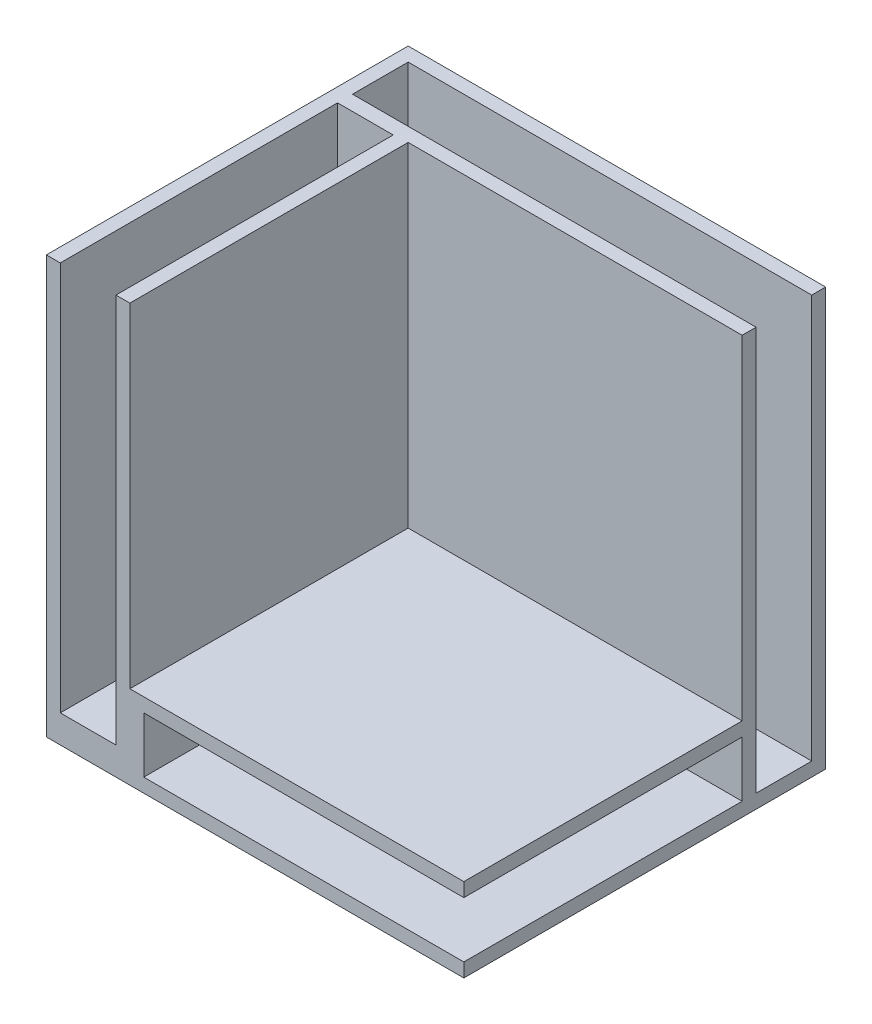
from build123d import *

# Parameters (mm, degrees)
SKETCH1_W            = 30
SKETCH1_H            = 30
BOSS_EXTRUDE1_DEPTH  = 6
BOSS_EXTRUDE4_DEPTH  = 20
SKETCH4_W            = 2
SKETCH4_H            = 2
BOSS_EXTRUDE6_DEPTH  = 20
SKETCH5_W            = 24
SKETCH5_H            = 6
BOSS_EXTRUDE7_DEPTH  = 20
SHELL2_START         = 7
SHELL2_DEPTH         = 23
SHELL2_START_2       = 1
SHELL2_2_DEPTH       = 4
SHELL2_START_3       = 5
SHELL2_3_OUTLINE_W   = 29
SHELL2_3_OUTLINE_H   = 4
SHELL2_3_DEPTH       = 2
SKETCH7_W            = 23
SKETCH7_H            = 1
BOSS_EXTRUDE8_DEPTH  = 5
SKETCH9_W            = 1.075143629
SKETCH9_H            = 23
BOSS_EXTRUDE9_DEPTH  = 5
SKETCH10_W           = 4
SKETCH10_H           = 23
CUT_EXTRUDE1_DEPTH   = 10
SKETCH11_W           = 23
SKETCH11_H           = 4
CUT_EXTRUDE2_DEPTH   = 10
BOSS_EXTRUDE11_DEPTH = 20
SKETCH14_W           = 4
SKETCH14_H           = 19.924856371
CUT_EXTRUDE4_DEPTH   = 5


# Read off the part's stored shape, not the designer's step: Shell2
with BuildPart() as part:
    # Sketch1 → Boss-Extrude1 (new body)
    with BuildSketch(Plane.XY):
        with Locations((15, 15)):
            Rectangle(SKETCH1_W, SKETCH1_H)
    extrude(amount=BOSS_EXTRUDE1_DEPTH)

    # Sketch2 → Boss-Extrude4 (add)
    with BuildSketch(Plane.XY.offset(6)):
        Polygon((5, 6), (6, 6), (6, 30), (0, 30), (0, 6), align=None)
    extrude(amount=BOSS_EXTRUDE4_DEPTH)

    # Sketch4 → Boss-Extrude6 (add)
    with BuildSketch(Plane.XY.offset(6)):
        with Locations((5, 5)):
            Rectangle(SKETCH4_W, SKETCH4_H)
    extrude(amount=BOSS_EXTRUDE6_DEPTH)

    # Sketch5 → Boss-Extrude7 (add)
    with BuildSketch(Plane.XY.offset(6)):
        with Locations((18, 3)):
            Rectangle(SKETCH5_W, SKETCH5_H)
    extrude(amount=BOSS_EXTRUDE7_DEPTH)

    # Shell2 outline → Shell2 (cut)
    with BuildSketch(Plane(origin=(0, 0, 0), x_dir=(1, 0, 0), z_dir=(0, 1, 0)).offset(SHELL2_START)):
        Polygon((5, -5), (30, -5), (30, -1), (1, -1), (1, -25), (5, -25), align=None)
    extrude(amount=SHELL2_DEPTH, mode=Mode.SUBTRACT)

    # Shell2 2 outline → Shell2 2 (cut)
    with BuildSketch(Plane(origin=(0, 0, 0), x_dir=(1, 0, 0), z_dir=(0, 1, 0)).offset(SHELL2_START_2)):
        Polygon((7, -5), (7, -25), (30, -25), (30, -1), (1, -1), (1, -5), align=None)
    extrude(amount=SHELL2_2_DEPTH, mode=Mode.SUBTRACT)

    # Shell2 3 outline → Shell2 3 (cut)
    with BuildSketch(Plane(origin=(0, 0, 0), x_dir=(1, 0, 0), z_dir=(0, 1, 0)).offset(SHELL2_START_3)):
        with Locations((15.5, -3)):
            Rectangle(SHELL2_3_OUTLINE_W, SHELL2_3_OUTLINE_H)
    extrude(amount=SHELL2_3_DEPTH, mode=Mode.SUBTRACT)

    # Sketch7 → Boss-Extrude8 (add)
    with BuildSketch(Plane.XZ.offset(-5)):
        with Locations((18.5, 5.5)):
            Rectangle(SKETCH7_W, SKETCH7_H)
    extrude(amount=BOSS_EXTRUDE8_DEPTH)

    # Sketch9 → Boss-Extrude9 (add)
    with BuildSketch(Plane.ZY.offset(-5)):
        with Locations((5.537571814, 18.5)):
            Rectangle(SKETCH9_W, SKETCH9_H)
    extrude(amount=BOSS_EXTRUDE9_DEPTH)

    # Sketch10 → Cut-Extrude1 (cut)
    with BuildSketch(Plane.XY.offset(26)):
        with Locations((3, 18.5)):
            Rectangle(SKETCH10_W, SKETCH10_H)
    extrude(amount=-CUT_EXTRUDE1_DEPTH, mode=Mode.SUBTRACT)

    # Sketch11 → Cut-Extrude2 (cut)
    with BuildSketch(Plane.XY.offset(26)):
        with Locations((18.5, 3)):
            Rectangle(SKETCH11_W, SKETCH11_H)
    extrude(amount=-CUT_EXTRUDE2_DEPTH, mode=Mode.SUBTRACT)

    # Sketch12 → Boss-Extrude11 (add)
    with BuildSketch(Plane.XY.offset(6)):
        Polygon((6, 0), (6, 4), (4, 4), (4, 6), (0, 6), (0, 0), align=None)
    extrude(amount=BOSS_EXTRUDE11_DEPTH)

    # Sketch14 → Cut-Extrude4 (cut)
    with BuildSketch(Plane(origin=(0, 7, 0), x_dir=(1, 0, 0), z_dir=(0, 1, 0))):
        with Locations((3, -16.037571815)):
            Rectangle(SKETCH14_W, SKETCH14_H)
    extrude(amount=-CUT_EXTRUDE4_DEPTH, mode=Mode.SUBTRACT)


solid = part.part
